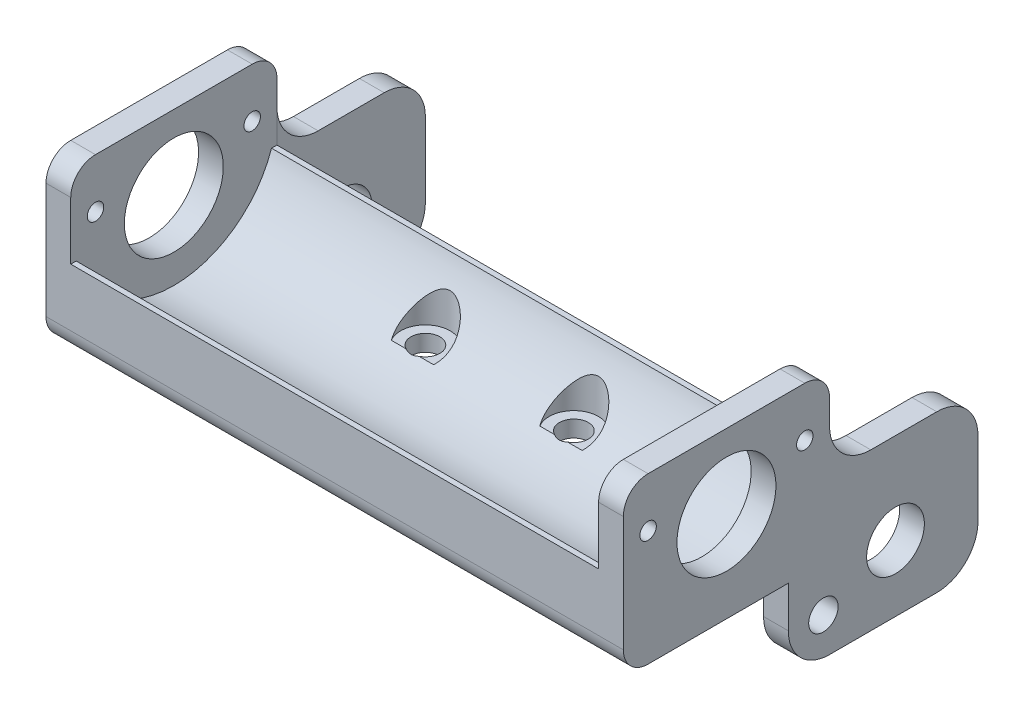
from build123d import *

# Parameters (mm, degrees)
SKETCH1_W            = 70
SKETCH1_H            = 25
BOSS_EXTRUDE1_DEPTH  = 10
SKETCH2_W            = 3
SKETCH2_H            = 25
BOSS_EXTRUDE2_DEPTH  = 10
SKETCH3_R            = 12.5
CUT_EXTRUDE1_DEPTH   = 67
SKETCH4_R            = 3
CUT_EXTRUDE2_DEPTH   = 41.868692174
SKETCH5_R            = 1.75
CUT_EXTRUDE3_DEPTH   = 41.868692259
SKETCH6_W            = 29
SKETCH6_H            = 13
CUT_EXTRUDE4_DEPTH   = 1
SKETCH9_W            = 25
SKETCH9_H            = 20
BOSS_EXTRUDE3_DEPTH  = 3
SKETCH8_R            = 6
SKETCH8_R_2          = 1
CUT_EXTRUDE6_DEPTH   = 74.866433513
FILLET1_R            = 3
SKETCH10_W           = 23
SKETCH10_H           = 19
BOSS_EXTRUDE4_DEPTH  = 3
FILLET2_R            = 5
SKETCH11_R           = 3.5
CUT_EXTRUDE7_DEPTH   = 79.931932702
FILLET2_OF_MIRROR2_R = 5
FILLET3_R            = 5
FILLET4_R            = 3
SKETCH12_R           = 1.784400781
CUT_EXTRUDE8_DEPTH   = 79.931932702


# Some blends are built 0.0001 mm under size
with BuildPart() as part:
    # Sketch1 → Boss-Extrude1 (new body)
    with BuildSketch(Plane(origin=(0, 0, 0), x_dir=(1, 0, 0), z_dir=(0, 1, 0))):
        Rectangle(SKETCH1_W, SKETCH1_H)
    extrude(amount=BOSS_EXTRUDE1_DEPTH)

    # Sketch2 → Boss-Extrude2 (add)
    with BuildSketch(Plane(origin=(0, 10, 0), x_dir=(1, 0, 0), z_dir=(0, 1, 0))):
        with Locations((-33.5, 0)):
            Rectangle(SKETCH2_W, SKETCH2_H)
    extrude(amount=BOSS_EXTRUDE2_DEPTH)

    # Sketch3 → Cut-Extrude1 (cut)
    with BuildSketch(Plane(origin=(35, 0, 0), x_dir=(0, 0, -1), z_dir=(1, 0, 0))):
        with Locations((0, 14)):
            Circle(SKETCH3_R)
    extrude(amount=-CUT_EXTRUDE1_DEPTH, mode=Mode.SUBTRACT)

    # Sketch4 → Cut-Extrude2 (cut, through all)
    with BuildSketch(Plane(origin=(0, 3, 0), x_dir=(1, 0, 0), z_dir=(0, 1, 0))):
        with Locations((-9, 7.5)):
            Circle(SKETCH4_R)
        with Locations((9, 7.5)):
            Circle(SKETCH4_R)
    cut_extrude2 = extrude(amount=CUT_EXTRUDE2_DEPTH, mode=Mode.SUBTRACT)

    # Sketch5 → Cut-Extrude3 (cut, through all)
    with BuildSketch(Plane(origin=(0, 3, 0), x_dir=(1, 0, 0), z_dir=(0, 1, 0))):
        with Locations(Location((-9, 7.5, 0), (0, 0, 270))):
            Circle(SKETCH5_R)
        with Locations(Location((9, 7.5, 0), (0, 0, 270))):
            Circle(SKETCH5_R)
    cut_extrude3 = extrude(amount=-CUT_EXTRUDE3_DEPTH, mode=Mode.SUBTRACT)

    # Sketch6 → Cut-Extrude4 (cut)
    with BuildSketch(Plane.XZ):
        with Locations((0, -6)):
            Rectangle(SKETCH6_W, SKETCH6_H)
    cut_extrude4 = extrude(amount=-CUT_EXTRUDE4_DEPTH, mode=Mode.SUBTRACT)

    # Mirror1: Cut-Extrude2, Cut-Extrude3, Cut-Extrude4 across plane
    add(cut_extrude2.mirror(Plane.XY), mode=Mode.SUBTRACT)
    add(cut_extrude3.mirror(Plane.XY), mode=Mode.SUBTRACT)
    add(cut_extrude4.mirror(Plane.XY), mode=Mode.SUBTRACT)

    # Sketch9 → Boss-Extrude3 (add)
    with BuildSketch(Plane(origin=(35, 0, 0), x_dir=(0, 0, -1), z_dir=(1, 0, 0))):
        with Locations((0, 10)):
            Rectangle(SKETCH9_W, SKETCH9_H)
    extrude(amount=-BOSS_EXTRUDE3_DEPTH)

    # Sketch8 → Cut-Extrude6 (cut, through all)
    with BuildSketch(Plane.ZY.offset(35)):
        with Locations((0, 11)):
            Circle(SKETCH8_R)
        with Locations((-9.5, 14)):
            Circle(SKETCH8_R_2)
        with Locations((9.5, 14)):
            Circle(SKETCH8_R_2)
    extrude(amount=-CUT_EXTRUDE6_DEPTH, mode=Mode.SUBTRACT)

    # Fillet1
    fillet1_edges = [part.edges().sort_by_distance(p)[0] for p in [
        (33.5, 20, 12.5),
        (33.5, 20, -12.5),
        (-33.5, 20, 12.5),
        (-33.5, 20, -12.5),
    ]]
    fillet(fillet1_edges, radius=FILLET1_R)

    # Sketch10 → Boss-Extrude4 (add)
    with BuildSketch(Plane(origin=(35, 0, 0), x_dir=(0, 0, -1), z_dir=(1, 0, 0))):
        with Locations((19, -0.5)):
            Rectangle(SKETCH10_W, SKETCH10_H)
    boss_extrude4 = extrude(amount=-BOSS_EXTRUDE4_DEPTH)

    # Fillet2
    fillet2_edges = [part.edges().sort_by_distance(p)[0] for p in [
        (33.5, -10, -7.5),
        (33.5, 9, -30.5),
        (33.5, -10, -30.5),
    ]]
    fillet(fillet2_edges, radius=FILLET2_R)

    # Sketch11 → Cut-Extrude7 (cut, through all)
    with BuildSketch(Plane(origin=(35, 0, 0), x_dir=(0, 0, -1), z_dir=(1, 0, 0))):
        with Locations((20.5, -2)):
            Circle(SKETCH11_R)
    cut_extrude7 = extrude(amount=-CUT_EXTRUDE7_DEPTH, mode=Mode.SUBTRACT)

    # Mirror2: Boss-Extrude4, Cut-Extrude7 across plane
    add(boss_extrude4.mirror(Plane(origin=(0, 0, 0), x_dir=(0, 0, 1), z_dir=(1, 0, 0))))
    add(cut_extrude7.mirror(Plane(origin=(0, 0, 0), x_dir=(0, 0, 1), z_dir=(1, 0, 0))), mode=Mode.SUBTRACT)

    # Fillet2 of Mirror2
    fillet2_of_mirror2_edges = [part.edges().sort_by_distance(p)[0] for p in [
        (-33.5, -10, -7.5),
        (-33.5, 9, -30.5),
        (-33.5, -10, -30.5),
    ]]
    fillet(fillet2_of_mirror2_edges, radius=FILLET2_OF_MIRROR2_R)

    # Fillet3
    # the kernel refuses this fillet: 5 mm, written as the material it adds along each edge
    with BuildSketch(Plane(origin=(35, 9, -12.5), x_dir=(0, 1, 0), z_dir=(-1, 0, 0)), Plane(origin=(-35, 9, -12.5), x_dir=(0, 0, -1), z_dir=(1, 0, 0))) as fillet3_piece_1:
        with BuildLine():
            CenterArc((FILLET3_R, FILLET3_R), FILLET3_R, 180, 90)
            Line((0, FILLET3_R), (0, 0))
            Line((0, 0), (FILLET3_R, 0))
        make_face()
    extrude(amount=3)

    # Fillet4
    fillet4_edges = [part.edges().sort_by_distance(p)[0] for p in [
        (24.75, 0, 12.5),
        (-23.25, 0, -12.5),
    ]]
    fillet(fillet4_edges, radius=FILLET4_R - 0.0001)  # a hair under: the kernel refuses the full size

    # Sketch12 → Cut-Extrude8 (cut, through all)
    with BuildSketch(Plane.ZY.offset(35)):
        with Locations((-11.755294266, -5.460778231)):
            Circle(SKETCH12_R)
    extrude(amount=-CUT_EXTRUDE8_DEPTH, mode=Mode.SUBTRACT)


solid = part.part
